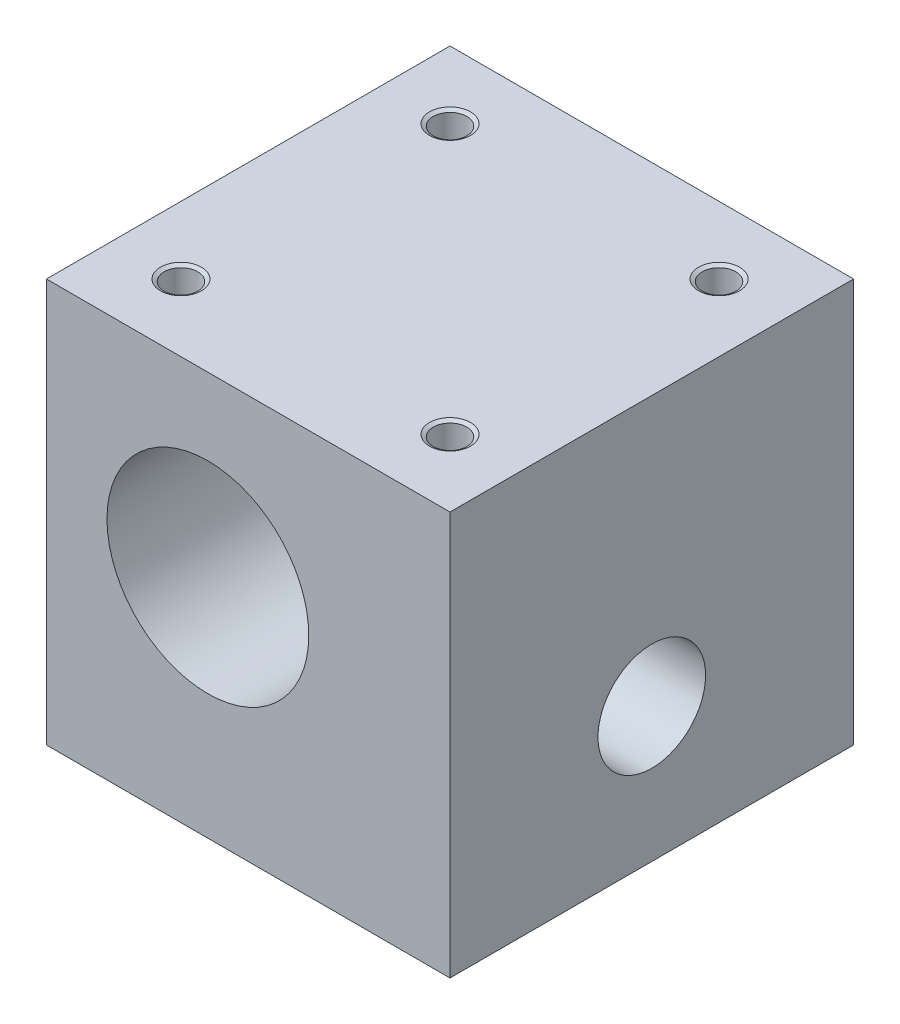
from build123d import *

# Parameters (mm, degrees)
SCHIZZO1_W                     = 30
SCHIZZO1_H                     = 30
SCHIZZO1_R                     = 7.5
ESTRUSIONE_ESTRUSIONE1_DEPTH   = 30
FORO_8_0_8_1_D                 = 8
FORO_8_0_8_1_DEPTH             = 10
FORO_8_0_8_1_TIP               = 2.403442476
FORO_FILETTATO_M3_1_AT_2_COUNT = 2
FORO_FILETTATO_M3_1_AT_2_PITCH = 20


with BuildPart() as part:
    # Schizzo1 → Estrusione-Estrusione1 (new body)
    with BuildSketch(Plane.XY):
        with Locations((15, 15)):
            Rectangle(SCHIZZO1_W, SCHIZZO1_H)
        with Locations((12, 16.8)):
            Circle(SCHIZZO1_R, mode=Mode.SUBTRACT)
    extrude(amount=ESTRUSIONE_ESTRUSIONE1_DEPTH)

    # Foro Ø8.0 (8)-1
    with Locations(Plane(origin=(30, 0, 0), x_dir=(0, 0, -1), z_dir=(1, 0, 0))):
        with Locations((-15, 10)):
            Hole(FORO_8_0_8_1_D / 2, depth=FORO_8_0_8_1_DEPTH)
            with Locations((0, 0, -(FORO_8_0_8_1_DEPTH + FORO_8_0_8_1_TIP / 2))):  # 118° drill point
                Cone(0, FORO_8_0_8_1_D / 2, FORO_8_0_8_1_TIP, mode=Mode.SUBTRACT)

    # Schizzo7 → Foro filettato M3-1 (revolve, cut)
    with BuildSketch(Plane(origin=(5, 30, 25), x_dir=(0, 0, 1), z_dir=(1, 0, 0))):
        Polygon((0, 0), (0, 9.251075774), (1.25, 8.5), (1.25, 0.158771324), (1.525, 0), align=None)
    foro_filettato_m3_1 = revolve(axis=Axis((5, 36.35, 25), (0, -1, 0)), mode=Mode.SUBTRACT)

    # Foro filettato M3-1 at 2: Foro filettato M3-1 ×2
    with Locations(*[(i * FORO_FILETTATO_M3_1_AT_2_PITCH, 0, 0) for i in range(1, FORO_FILETTATO_M3_1_AT_2_COUNT)]):
        add(foro_filettato_m3_1, mode=Mode.SUBTRACT)

    # Specchia1: Foro filettato M3-1 across plane
    add(foro_filettato_m3_1.mirror(Plane.XY.offset(15)), mode=Mode.SUBTRACT)

    # Specchia1 copy 1 sketch → Specchia1 copy 1 (revolve, cut)
    with BuildSketch(Plane(origin=(25, 30, 5), x_dir=(0, 0, -1), z_dir=(1, 0, 0))):
        Polygon((0, 0), (0, -9.251075774), (1.25, -8.5), (1.25, -0.158771324), (1.525, 0), align=None)
    revolve(axis=Axis((25, 36.35, 5), (0, 1, 0)), mode=Mode.SUBTRACT)


solid = part.part
